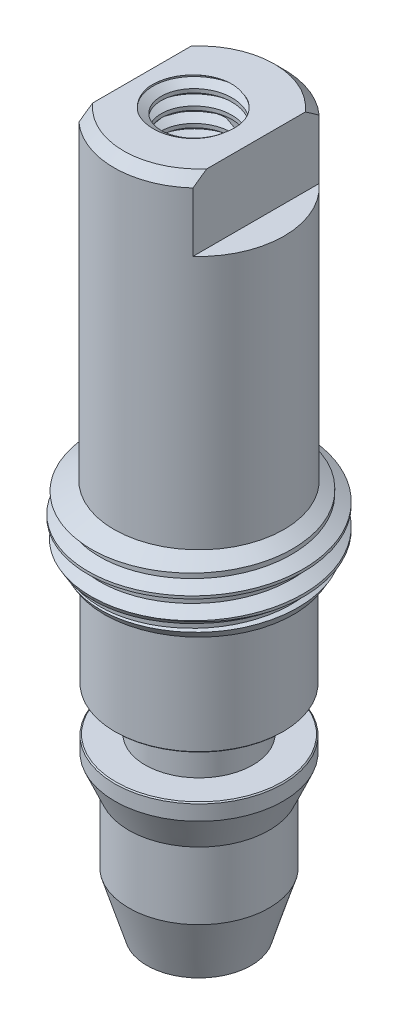
from build123d import *
from OCP.BRepFilletAPI import BRepFilletAPI_MakeChamfer

# Parameters (mm, degrees)
SKETCH2_R                       = 5
BOSS_EXTRUDE1_DEPTH             = 3.2
SKETCH3_R                       = 3.95
BOSS_EXTRUDE2_DEPTH             = 15
SKETCH4_OUTSIDE_W               = 16.61
SKETCH4_OUTSIDE_H               = 16.61
SKETCH4_OUTSIDE_W_2             = 5.3
SKETCH4_OUTSIDE_H_2             = 13
CUT_EXTRUDE1_DEPTH              = 3.2
SKETCH5_OUTSIDE_W               = 36.61
SKETCH5_OUTSIDE_H               = 36.61
SKETCH5_OUTSIDE_R               = 3.5
CUT_EXTRUDE2_DEPTH              = 10
CUT_EXTRUDE2_DRAFT              = -45
SKETCH7_R                       = 3.91
BOSS_EXTRUDE3_DEPTH             = 5
SKETCH8_R                       = 2.5
BOSS_EXTRUDE4_DEPTH             = 2
SKETCH9_R                       = 3.91
BOSS_EXTRUDE5_DEPTH             = 2.25
SKETCH10_R                      = 3.26
BOSS_EXTRUDE6_DEPTH             = 5.85
CHAMFER1_SIZE                   = 0.05
CHAMFER2_SIZE                   = 0.05
CHAMFER3_SIZE                   = 1.5
CHAMFER3_SIZE_2                 = 0.652218562
SKETCH12_OUTSIDE_W              = 22.812
SKETCH12_OUTSIDE_H              = 22.812
SKETCH12_OUTSIDE_R              = 2.425
CUT_EXTRUDE3_DEPTH              = 5.85
CUT_EXTRUDE3_DRAFT              = -17
CHAMFER4_SIZE                   = 0.606217783
CHAMFER4_SIZE_2                 = 1.05
THREAD1_PITCH                   = 1
TAP_DRILL_FOR_M4X0_7_TAP2_D     = 3.3
TAP_DRILL_FOR_M4X0_7_TAP2_DEPTH = 14.008579979
TAP_DRILL_FOR_M4X0_7_TAP2_TIP   = 0.991420021
THREAD2_PITCH                   = 0.7


# Some blends are built 0.0001 mm under size
with BuildPart() as part:
    # Sketch2 → Boss-Extrude1 (new body)
    with BuildSketch(Plane(origin=(0, 0, 0), x_dir=(1, 0, 0), z_dir=(0, 1, 0))):
        with Locations(Location((0, 0, 0), (0, 0, 270))):
            Circle(SKETCH2_R)
    extrude(amount=BOSS_EXTRUDE1_DEPTH)

    # Sketch3 → Boss-Extrude2 (add)
    with BuildSketch(Plane(origin=(0, 3.2, 0), x_dir=(1, 0, 0), z_dir=(0, 1, 0))):
        with Locations(Location((0, 0, 0), (0, 0, 270))):
            Circle(SKETCH3_R)
    extrude(amount=BOSS_EXTRUDE2_DEPTH)

    # Sketch4 outside → Cut-Extrude1 (cut)
    with BuildSketch(Plane(origin=(0, 18.2, 0), x_dir=(1, 0, 0), z_dir=(0, 1, 0))):
        Rectangle(SKETCH4_OUTSIDE_W, SKETCH4_OUTSIDE_H)
        Rectangle(SKETCH4_OUTSIDE_W_2, SKETCH4_OUTSIDE_H_2, mode=Mode.SUBTRACT)
    extrude(amount=-CUT_EXTRUDE1_DEPTH, mode=Mode.SUBTRACT)


with BuildPart() as cut_extrude2_tool:
    # Sketch5 outside → Cut-Extrude2 (with draft: the straight prism first)
    with BuildSketch(Plane(origin=(0, 18.2, 0), x_dir=(1, 0, 0), z_dir=(0, 1, 0))):
        Rectangle(SKETCH5_OUTSIDE_W, SKETCH5_OUTSIDE_H)
        Circle(SKETCH5_OUTSIDE_R, mode=Mode.SUBTRACT)
    extrude(amount=-CUT_EXTRUDE2_DEPTH)
    # Cut-Extrude2: the draft: its side faces are tilted about the plane it starts from
    cut_extrude2_sides = [cut_extrude2_tool.faces().sort_by_distance(p)[0] for p in [
        (0, 13.2, 18.305),
        (18.305, 13.2, 0),
        (0, 13.2, -18.305),
        (-18.305, 13.2, 0),
        (-3.5, 13.2, 0),
    ]]
    draft(cut_extrude2_sides, Plane(origin=(0, 18.2, 0), x_dir=(1, 0, 0), z_dir=(0, 1, 0)), CUT_EXTRUDE2_DRAFT)


with BuildPart() as part_1:
    add(part.part)

    # Cut-Extrude2: cut by cut_extrude2_tool
    add(cut_extrude2_tool.part, mode=Mode.SUBTRACT)

    # Sketch7 → Boss-Extrude3 (add)
    with BuildSketch(Plane.XZ):
        with Locations(Location((0, 0, 0), (0, 0, 270))):
            Circle(SKETCH7_R)
    extrude(amount=BOSS_EXTRUDE3_DEPTH)

    # Sketch8 → Boss-Extrude4 (add)
    with BuildSketch(Plane.XZ.offset(5)):
        with Locations(Location((0, 0, 0), (0, 0, 270))):
            Circle(SKETCH8_R)
    extrude(amount=BOSS_EXTRUDE4_DEPTH)

    # Sketch9 → Boss-Extrude5 (add)
    with BuildSketch(Plane.XZ.offset(7)):
        with Locations(Location((0, 0, 0), (0, 0, 270))):
            Circle(SKETCH9_R)
    extrude(amount=BOSS_EXTRUDE5_DEPTH)

    # Sketch10 → Boss-Extrude6 (add)
    with BuildSketch(Plane.XZ.offset(9.25)):
        with Locations(Location((0, 0, 0), (0, 0, 270))):
            Circle(SKETCH10_R)
    extrude(amount=BOSS_EXTRUDE6_DEPTH)

    # Chamfer1
    chamfer1_edges = [part_1.edges().sort_by_distance(p)[0] for p in [
        (0, -5, 3.91),
    ]]
    chamfer(chamfer1_edges, length=CHAMFER1_SIZE)

    # Chamfer2
    chamfer2_edges = [part_1.edges().sort_by_distance(p)[0] for p in [
        (0, -7, 3.91),
    ]]
    chamfer(chamfer2_edges, length=CHAMFER2_SIZE)

    # Chamfer3
    # the kernel refuses this chamfer: 1.5, 0.652218562 mm, written as the material it takes off along each edge
    with BuildSketch(Plane(origin=(0, -9.25, 0), x_dir=(0, 0, -1), z_dir=(-1, 0, 0))) as chamfer3_piece_1_section:
        Polygon((3.91, -CHAMFER3_SIZE), (3.91 - CHAMFER3_SIZE_2, 0), (3.91, 0), align=None)
    chamfer3_piece_1 = revolve(axis=Axis((0, -9.25, 0), (0, -1, 0)), mode=Mode.PRIVATE)
    chamfer3_piece_1 = chamfer3_piece_1 - Plane(origin=(0, -8.479357358, 0), x_dir=(0, 0, -1), z_dir=(0, 1, 0)) * Cylinder(3.26, 16, mode=Mode.PRIVATE)
    add(chamfer3_piece_1, mode=Mode.SUBTRACT)


with BuildPart() as cut_extrude3_tool:
    # Sketch12 outside → Cut-Extrude3 (with draft: the straight prism first)
    with BuildSketch(Plane.XZ.offset(15.1)):
        Rectangle(SKETCH12_OUTSIDE_W, SKETCH12_OUTSIDE_H)
        Circle(SKETCH12_OUTSIDE_R, mode=Mode.SUBTRACT)
    extrude(amount=-CUT_EXTRUDE3_DEPTH)
    # Cut-Extrude3: the draft: its side faces are tilted about the plane it starts from
    cut_extrude3_sides = [cut_extrude3_tool.faces().sort_by_distance(p)[0] for p in [
        (0, -12.175, -11.406),
        (11.406, -12.175, 0),
        (0, -12.175, 11.406),
        (-11.406, -12.175, 0),
        (-2.425, -12.175, 0),
    ]]
    draft(cut_extrude3_sides, Plane.XZ.offset(15.1), CUT_EXTRUDE3_DRAFT)


with BuildPart() as part_2:
    add(part_1.part)

    # Cut-Extrude3: cut by cut_extrude3_tool
    add(cut_extrude3_tool.part, mode=Mode.SUBTRACT)

    # Chamfer4
    chamfer4_edges_1 = [part_2.edges().sort_by_distance(p)[0] for p in [
        (0, 0, -5),
    ]]
    chamfer4_side_1 = [part_2.faces().sort_by_distance(p)[0] for p in [
        (0, 0, -4.987875644),
    ]]
    chamfer4_edges_2 = [part_2.edges().sort_by_distance(p)[0] for p in [
        (0, 3.2, -5),
    ]]
    chamfer4_side_2 = [part_2.faces().sort_by_distance(p)[0] for p in [
        (0, 3.187875644, -5),
    ]]
    chamfer4 = BRepFilletAPI_MakeChamfer(part_2.part.solid().wrapped)
    for e in chamfer4_edges_1:
        chamfer4.Add(CHAMFER4_SIZE - 0.0001, CHAMFER4_SIZE_2 - 0.0001, e.wrapped, chamfer4_side_1[0].wrapped)
    for e in chamfer4_edges_2:
        chamfer4.Add(CHAMFER4_SIZE - 0.0001, CHAMFER4_SIZE_2 - 0.0001, e.wrapped, chamfer4_side_2[0].wrapped)
    add(Compound.cast(chamfer4.Shape()), mode=Mode.REPLACE)  # a hair under: the kernel refuses the full size

    # Thread1: the profile of Thread Profile1 profile screwed along a right-hand helix of 7.543782 turns, 8 arcs to a turn; built about Z, then put on its axis
    thread1_z = Axis((0, 0, 0), (0, 0, 1))
    thread1_corners = [(5.0003, 0, -0.000173205), (5.0003, 0, 0.875173202), (4.458734125, 0, 0.562499998), (4.458734125, 0, 0.312499998)]
    with BuildLine(mode=Mode.PRIVATE) as thread1_profile:
        Line(thread1_corners[0], thread1_corners[1])
        Line(thread1_corners[1], thread1_corners[2])
        Line(thread1_corners[2], thread1_corners[3])
        Line(thread1_corners[3], thread1_corners[0])
    thread1_cap = Face(thread1_profile.wire())
    thread1_turn_angles = [0, 22.5, 45, 67.5, 90, 112.5, 135, 157.5, 180, 202.5, 225, 247.5, 270, 292.5, 315, 337.5, 360]
    thread1_turn_weights = [1, 0.9238795325112867, 1, 0.9238795325112867, 1, 0.9238795325112867, 1, 0.9238795325112867, 1, 0.9238795325112867, 1, 0.9238795325112867, 1, 0.9238795325112867, 1, 0.9238795325112867, 1]
    thread1_turn_rails = [Edge.make_bspline([Vector(p[0], p[1], 0).rotate(thread1_z, thread1_turn_angles[k]) / thread1_turn_weights[k] + Vector(0, 0, p[2] + THREAD1_PITCH * thread1_turn_angles[k] / 360) for k in range(17)], [0, 0, 0, 1, 1, 2, 2, 3, 3, 4, 4, 5, 5, 6, 6, 7, 7, 8, 8, 8], 2, thread1_turn_weights) for p in thread1_corners]
    thread1_turn_sides = [Face.make_surface_from_curves(thread1_turn_rails[p[0]], thread1_turn_rails[p[1]]) for p in [(0, 1), (1, 2), (2, 3), (3, 0)]]
    thread1_last_angles = [2520, 2542.5, 2565, 2587.5, 2610, 2632.5, 2655, 2677.5, 2700, 2707.880799123, 2715.761598246]
    thread1_last_weights = [1, 0.9238795325112867, 1, 0.9238795325112867, 1, 0.9238795325112867, 1, 0.9238795325112867, 1, 0.9905554678310162, 1]
    thread1_last_rails = [Edge.make_bspline([Vector(p[0], p[1], 0).rotate(thread1_z, thread1_last_angles[k]) / thread1_last_weights[k] + Vector(0, 0, p[2] + THREAD1_PITCH * thread1_last_angles[k] / 360) for k in range(11)], [0, 0, 0, 1, 1, 2, 2, 3, 3, 4, 4, 5, 5, 5], 2, thread1_last_weights) for p in thread1_corners]
    thread1_last_sides = [Face.make_surface_from_curves(thread1_last_rails[p[0]], thread1_last_rails[p[1]]) for p in [(0, 1), (1, 2), (2, 3), (3, 0)]]
    thread1 = Plane(origin=(0, 5.593782217, 0), x_dir=(-1, 0, 0), z_dir=(0, -1, 0)) * Solid(Shell([*[p.moved(Location((0, 0, THREAD1_PITCH * i))) for i in range(7) for p in thread1_turn_sides], *thread1_last_sides, thread1_cap, thread1_cap.rotate(thread1_z, 2715.761598246).moved(Location((0, 0, THREAD1_PITCH * 2715.761598246 / 360)))]))
    add(thread1, mode=Mode.SUBTRACT)

    # Tap Drill for M4x0.7 Tap2
    with Locations(Plane(origin=(0, 18.2, 0), x_dir=(1, 0, 0), z_dir=(0, 1, 0))):
        with Locations((0, 0)):
            Hole(TAP_DRILL_FOR_M4X0_7_TAP2_D / 2, depth=TAP_DRILL_FOR_M4X0_7_TAP2_DEPTH)
            with Locations((0, 0, -(TAP_DRILL_FOR_M4X0_7_TAP2_DEPTH + TAP_DRILL_FOR_M4X0_7_TAP2_TIP / 2))):  # 118° drill point
                Cone(0, TAP_DRILL_FOR_M4X0_7_TAP2_D / 2, TAP_DRILL_FOR_M4X0_7_TAP2_TIP, mode=Mode.SUBTRACT)

    # Thread2: the profile of Thread Profile2 profile screwed along a right-hand helix of 24.297971 turns, 6 arcs to a turn; built about Z, then put on its axis
    thread2_z = Axis((0, 0, 0), (0, 0, 1))
    thread2_corners = [(1.6497, 0, -0.000173205), (2.028886112, 0, 0.218749999), (2.028886112, 0, 0.306249999), (1.6497, 0, 0.525173203)]
    with BuildLine(mode=Mode.PRIVATE) as thread2_profile:
        Line(thread2_corners[0], thread2_corners[1])
        Line(thread2_corners[1], thread2_corners[2])
        Line(thread2_corners[2], thread2_corners[3])
        Line(thread2_corners[3], thread2_corners[0])
    thread2_cap = Face(thread2_profile.wire())
    thread2_turn_angles = [0, 30, 60, 90, 120, 150, 180, 210, 240, 270, 300, 330, 360]
    thread2_turn_weights = [1, 0.8660254037844387, 1, 0.8660254037844387, 1, 0.8660254037844387, 1, 0.8660254037844387, 1, 0.8660254037844387, 1, 0.8660254037844387, 1]
    thread2_turn_rails = [Edge.make_bspline([Vector(p[0], p[1], 0).rotate(thread2_z, thread2_turn_angles[k]) / thread2_turn_weights[k] + Vector(0, 0, p[2] + THREAD2_PITCH * thread2_turn_angles[k] / 360) for k in range(13)], [0, 0, 0, 1, 1, 2, 2, 3, 3, 4, 4, 5, 5, 6, 6, 6], 2, thread2_turn_weights) for p in thread2_corners]
    thread2_turn_sides = [Face.make_surface_from_curves(thread2_turn_rails[p[0]], thread2_turn_rails[p[1]]) for p in [(0, 1), (1, 2), (2, 3), (3, 0)]]
    thread2_last_angles = [8640, 8670, 8700, 8723.634851641, 8747.269703282]
    thread2_last_weights = [1, 0.8660254037844387, 1, 0.916119037387061, 1]
    thread2_last_rails = [Edge.make_bspline([Vector(p[0], p[1], 0).rotate(thread2_z, thread2_last_angles[k]) / thread2_last_weights[k] + Vector(0, 0, p[2] + THREAD2_PITCH * thread2_last_angles[k] / 360) for k in range(5)], [0, 0, 0, 1, 1, 2, 2, 2], 2, thread2_last_weights) for p in thread2_corners]
    thread2_last_sides = [Face.make_surface_from_curves(thread2_last_rails[p[0]], thread2_last_rails[p[1]]) for p in [(0, 1), (1, 2), (2, 3), (3, 0)]]
    thread2 = Plane(origin=(0, 21.2, 0), x_dir=(-1, 0, 0), z_dir=(0, -1, 0)) * Solid(Shell([*[p.moved(Location((0, 0, THREAD2_PITCH * i))) for i in range(24) for p in thread2_turn_sides], *thread2_last_sides, thread2_cap, thread2_cap.rotate(thread2_z, 8747.269703282).moved(Location((0, 0, THREAD2_PITCH * 8747.269703282 / 360)))]))
    add(thread2, mode=Mode.SUBTRACT)


solid = part_2.part
